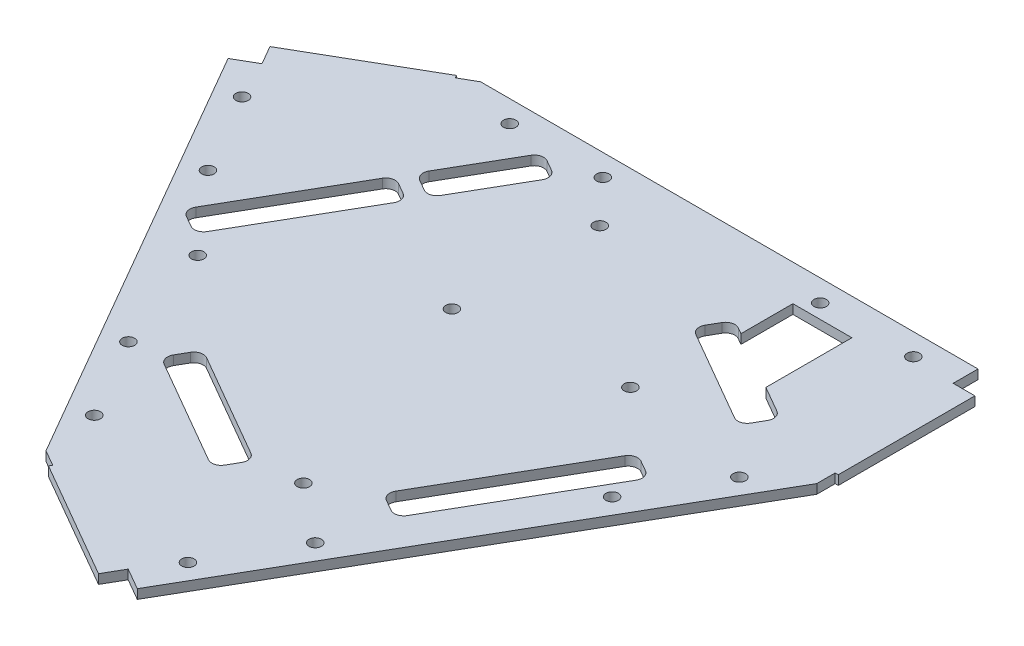
from build123d import *

# Parameters (mm, degrees)
EXTRUSION1_DEPTH         = 3
ENL_V_MAT_EXTRU_14_REACH = 176.1
ESQUISSE8_R              = 2
ESQUISSE10_R             = 2
ENL_V_MAT_EXTRU_16_DEPTH = 175.099861741
ENL_V_MAT_EXTRU_17_DEPTH = 175.099861741
ENL_V_MAT_EXTRU_18_DEPTH = 167.529952384
CONG_1_R                 = 3


with BuildPart() as part:
    # Esquisse1 → Extrusion1 (new body)
    with BuildSketch(Plane(origin=(0, 0, 0), x_dir=(1, 0, 0), z_dir=(0, 1, 0))):
        Polygon((-64.179491924, 79.940798285), (98.820508076, 79.940798285), (103.820508076, 74.940798285), (103.820508076, 24.940798285), (101.320508076, 15.610671266), (19.820508076, -125.551469551), (12.990381057, -127.38159657), (-30.310889132, -102.38159657), (-37.141016151, -95.551469551), (-118.641016151, 45.610671266), (-116.810889132, 52.440798285), (-73.509618943, 77.440798285), align=None)
    extrude(amount=EXTRUSION1_DEPTH)

    # Esquisse8 → Enlèv. mat.-Extru.14 (cut, up to next)
    with BuildSketch(Plane(origin=(0, 3, 0), x_dir=(1, 0, 0), z_dir=(0, 1, 0)), mode=Mode.PRIVATE) as enl_v_mat_extru_14_sk1:
        with Locations((-100.570508076, 34.31163316)):
            Circle(ESQUISSE8_R)
    enl_v_mat_extru_14_tool1 = extrude(enl_v_mat_extru_14_sk1.sketch, amount=-ENL_V_MAT_EXTRU_14_REACH, mode=Mode.PRIVATE) & part.part
    # Esquisse8 → Enlèv. mat.-Extru.14 (cut, up to next)
    with BuildSketch(Plane(origin=(0, 3, 0), x_dir=(1, 0, 0), z_dir=(0, 1, 0)), mode=Mode.PRIVATE) as enl_v_mat_extru_14_sk2:
        with Locations((80, 69.940798285)):
            Circle(ESQUISSE8_R)
    enl_v_mat_extru_14_tool2 = extrude(enl_v_mat_extru_14_sk2.sketch, amount=-ENL_V_MAT_EXTRU_14_REACH, mode=Mode.PRIVATE) & part.part
    # Esquisse8 → Enlèv. mat.-Extru.14 (cut, up to next)
    with BuildSketch(Plane(origin=(0, 3, 0), x_dir=(1, 0, 0), z_dir=(0, 1, 0)), mode=Mode.PRIVATE) as enl_v_mat_extru_14_sk3:
        with Locations((50, 69.940798285)):
            Circle(ESQUISSE8_R)
    enl_v_mat_extru_14_tool3 = extrude(enl_v_mat_extru_14_sk3.sketch, amount=-ENL_V_MAT_EXTRU_14_REACH, mode=Mode.PRIVATE) & part.part
    # Esquisse8 → Enlèv. mat.-Extru.14 (cut, up to next)
    with BuildSketch(Plane(origin=(0, 3, 0), x_dir=(1, 0, 0), z_dir=(0, 1, 0)), mode=Mode.PRIVATE) as enl_v_mat_extru_14_sk4:
        with Locations((-50.570508076, -52.290907218)):
            Circle(ESQUISSE8_R)
    enl_v_mat_extru_14_tool4 = extrude(enl_v_mat_extru_14_sk4.sketch, amount=-ENL_V_MAT_EXTRU_14_REACH, mode=Mode.PRIVATE) & part.part
    # Esquisse8 → Enlèv. mat.-Extru.14 (cut, up to next)
    with BuildSketch(Plane(origin=(0, 3, 0), x_dir=(1, 0, 0), z_dir=(0, 1, 0)), mode=Mode.PRIVATE) as enl_v_mat_extru_14_sk5:
        with Locations((-35.570508076, -78.271669332)):
            Circle(ESQUISSE8_R)
    enl_v_mat_extru_14_tool5 = extrude(enl_v_mat_extru_14_sk5.sketch, amount=-ENL_V_MAT_EXTRU_14_REACH, mode=Mode.PRIVATE) & part.part
    # Esquisse8 → Enlèv. mat.-Extru.14 (cut, up to next)
    with BuildSketch(Plane(origin=(0, 3, 0), x_dir=(1, 0, 0), z_dir=(0, 1, 0)), mode=Mode.PRIVATE) as enl_v_mat_extru_14_sk6:
        with Locations((-20, 69.940798285)):
            Circle(ESQUISSE8_R)
    enl_v_mat_extru_14_tool6 = extrude(enl_v_mat_extru_14_sk6.sketch, amount=-ENL_V_MAT_EXTRU_14_REACH, mode=Mode.PRIVATE) & part.part
    # Esquisse8 → Enlèv. mat.-Extru.14 (cut, up to next)
    with BuildSketch(Plane(origin=(0, 3, 0), x_dir=(1, 0, 0), z_dir=(0, 1, 0)), mode=Mode.PRIVATE) as enl_v_mat_extru_14_sk7:
        with Locations((-50, 69.940798285)):
            Circle(ESQUISSE8_R)
    enl_v_mat_extru_14_tool7 = extrude(enl_v_mat_extru_14_sk7.sketch, amount=-ENL_V_MAT_EXTRU_14_REACH, mode=Mode.PRIVATE) & part.part
    # Esquisse8 → Enlèv. mat.-Extru.14 (cut, up to next)
    with BuildSketch(Plane(origin=(0, 3, 0), x_dir=(1, 0, 0), z_dir=(0, 1, 0)), mode=Mode.PRIVATE) as enl_v_mat_extru_14_sk8:
        with Locations((20.570508076, -104.252431445)):
            Circle(ESQUISSE8_R)
    enl_v_mat_extru_14_tool8 = extrude(enl_v_mat_extru_14_sk8.sketch, amount=-ENL_V_MAT_EXTRU_14_REACH, mode=Mode.PRIVATE) & part.part
    # Esquisse8 → Enlèv. mat.-Extru.14 (cut, up to next)
    with BuildSketch(Plane(origin=(0, 3, 0), x_dir=(1, 0, 0), z_dir=(0, 1, 0)), mode=Mode.PRIVATE) as enl_v_mat_extru_14_sk9:
        with Locations((35.570508076, -78.271669332)):
            Circle(ESQUISSE8_R)
    enl_v_mat_extru_14_tool9 = extrude(enl_v_mat_extru_14_sk9.sketch, amount=-ENL_V_MAT_EXTRU_14_REACH, mode=Mode.PRIVATE) & part.part
    # Esquisse8 → Enlèv. mat.-Extru.14 (cut, up to next)
    with BuildSketch(Plane(origin=(0, 3, 0), x_dir=(1, 0, 0), z_dir=(0, 1, 0)), mode=Mode.PRIVATE) as enl_v_mat_extru_14_sk10:
        with Locations((-85.570508076, 8.330871047)):
            Circle(ESQUISSE8_R)
    enl_v_mat_extru_14_tool10 = extrude(enl_v_mat_extru_14_sk10.sketch, amount=-ENL_V_MAT_EXTRU_14_REACH, mode=Mode.PRIVATE) & part.part
    # Esquisse8 → Enlèv. mat.-Extru.14 (cut, up to next)
    with BuildSketch(Plane(origin=(0, 3, 0), x_dir=(1, 0, 0), z_dir=(0, 1, 0)), mode=Mode.PRIVATE) as enl_v_mat_extru_14_sk11:
        with Locations((70.570508076, -17.649891067)):
            Circle(ESQUISSE8_R)
    enl_v_mat_extru_14_tool11 = extrude(enl_v_mat_extru_14_sk11.sketch, amount=-ENL_V_MAT_EXTRU_14_REACH, mode=Mode.PRIVATE) & part.part
    # Esquisse8 → Enlèv. mat.-Extru.14 (cut, up to next)
    with BuildSketch(Plane(origin=(0, 3, 0), x_dir=(1, 0, 0), z_dir=(0, 1, 0)), mode=Mode.PRIVATE) as enl_v_mat_extru_14_sk12:
        with Locations((85.570508076, 8.330871047)):
            Circle(ESQUISSE8_R)
    enl_v_mat_extru_14_tool12 = extrude(enl_v_mat_extru_14_sk12.sketch, amount=-ENL_V_MAT_EXTRU_14_REACH, mode=Mode.PRIVATE) & part.part
    add(enl_v_mat_extru_14_tool1.solids().sort_by_distance((-100.570508, 3, -34.311633))[0], mode=Mode.SUBTRACT)
    add(enl_v_mat_extru_14_tool2.solids().sort_by_distance((80, 3, -69.940798))[0], mode=Mode.SUBTRACT)
    add(enl_v_mat_extru_14_tool3.solids().sort_by_distance((50, 3, -69.940798))[0], mode=Mode.SUBTRACT)
    add(enl_v_mat_extru_14_tool4.solids().sort_by_distance((-50.570508, 3, 52.290907))[0], mode=Mode.SUBTRACT)
    add(enl_v_mat_extru_14_tool5.solids().sort_by_distance((-35.570508, 3, 78.271669))[0], mode=Mode.SUBTRACT)
    add(enl_v_mat_extru_14_tool6.solids().sort_by_distance((-20, 3, -69.940798))[0], mode=Mode.SUBTRACT)
    add(enl_v_mat_extru_14_tool7.solids().sort_by_distance((-50, 3, -69.940798))[0], mode=Mode.SUBTRACT)
    add(enl_v_mat_extru_14_tool8.solids().sort_by_distance((20.570508, 3, 104.252431))[0], mode=Mode.SUBTRACT)
    add(enl_v_mat_extru_14_tool9.solids().sort_by_distance((35.570508, 3, 78.271669))[0], mode=Mode.SUBTRACT)
    add(enl_v_mat_extru_14_tool10.solids().sort_by_distance((-85.570508, 3, -8.330871))[0], mode=Mode.SUBTRACT)
    add(enl_v_mat_extru_14_tool11.solids().sort_by_distance((70.570508, 3, 17.649891))[0], mode=Mode.SUBTRACT)
    add(enl_v_mat_extru_14_tool12.solids().sort_by_distance((85.570508, 3, -8.330871))[0], mode=Mode.SUBTRACT)

    # Esquisse10 → Enlèv. mat.-Extru.16 (cut, through all)
    with BuildSketch(Plane(origin=(0, 3, 0), x_dir=(1, 0, 0), z_dir=(0, 1, 0))):
        with Locations((-63.520181276, -17.020181276)):
            Circle(ESQUISSE10_R)
        with Locations((17.020181276, -63.520181276)):
            Circle(ESQUISSE10_R)
        with Locations((42.965884077, 15.839094213)):
            Circle(ESQUISSE10_R)
        with Locations((-7.629221728, 8.965800345)):
            Circle(ESQUISSE10_R)
        with Locations((-7.029145761, 55.985162408)):
            Circle(ESQUISSE10_R)
    extrude(amount=-ENL_V_MAT_EXTRU_16_DEPTH, mode=Mode.SUBTRACT)

    # Esquisse12 → Enlèv. mat.-Extru.17 (cut, through all)
    with BuildSketch(Plane(origin=(0, 3, 0), x_dir=(1, 0, 0), z_dir=(0, 1, 0))):
        Polygon((98.820508076, 79.940798285), (93.820508076, 79.940798285), (-64.179491924, 79.940798285), (-73.509618943, 77.440798285), (-116.810889132, 52.440798285), (-117.908965344, 48.342722073), (-118.641016151, 45.610671266), (-116.141016151, 41.280544247), (-37.141016151, -95.551469551), (-30.310889132, -102.38159657), (12.990381057, -127.38159657), (17.088457269, -126.283520358), (19.820508076, -125.551469551), (22.320508076, -121.221342532), (101.320508076, 15.610671266), (103.820508076, 24.940798285), (103.820508076, 74.940798285), (100.820508076, 77.940798285), align=None)
        Polygon((-66.375644347, 76.940798285), (-65.977450895, 76.940798285), (93.820508076, 76.940798285), (93.820508076, 68.940798285), (100.820508076, 68.940798285), (100.820508076, 24.940798285), (99.820508076, 24.940798285), (99.820508076, 19.012595055), (99.62141135, 18.66774941), (19.722431865, -119.721342532), (12.794228634, -115.721342532), (9.294228634, -121.783520358), (-28.810889132, -99.783520358), (-28.310889132, -98.917494955), (-33.444863728, -95.953393339), (-33.643960454, -95.608547695), (-113.54293994, 42.780544247), (-106.61473671, 46.780544247), (-110.11473671, 52.842722074), (-72.009618943, 74.842722074), (-71.509618943, 73.97669667), align=None, mode=Mode.SUBTRACT)
    extrude(amount=-ENL_V_MAT_EXTRU_17_DEPTH, mode=Mode.SUBTRACT)

    # Esquisse13 → Enlèv. mat.-Extru.18 (cut, through all)
    with BuildSketch(Plane(origin=(0, 3, 0), x_dir=(1, 0, 0), z_dir=(0, 1, 0))):
        Polygon((-70.131397208, -11.47114317), (-45.131397208, 31.830127019), (-53.791651246, 36.830127019), (-78.791651246, -6.47114317), align=None)
        Polygon((-51.291651246, 41.160254038), (-36.291651246, 67.141016151), (-27.631397208, 62.141016151), (-42.631397208, 36.160254038), align=None)
        Polygon((32.631397208, -53.480762114), (62.631397208, -1.519237886), (71.291651246, -6.519237886), (41.291651246, -58.480762114), align=None)
        Polygon((70.801270189, 22.631397208), (36.160254038, 42.631397208), (41.160254038, 51.291651246), (45.803878216, 48.610653577), (45.803878216, 65.342402688), (64.803878216, 65.342402688), (64.803878216, 46.342402688), (64.803878216, 37.640998462), (75.801270189, 31.291651246), align=None)
        Polygon((2.810889132, -65.131397208), (-36.160254038, -42.631397208), (-41.160254038, -51.291651246), (-2.189110868, -73.791651246), align=None)
    extrude(amount=-ENL_V_MAT_EXTRU_18_DEPTH, mode=Mode.SUBTRACT)

    # Congé1
    cong_1_edges = [part.edges().sort_by_distance(p)[0] for p in [
        (-41.160254038, 1.5, 51.291651246),
        (-36.160254038, 1.5, 42.631397208),
        (2.810889132, 1.5, 65.131397208),
        (-2.189110868, 1.5, 73.791651246),
        (32.631397208, 1.5, 53.480762114),
        (41.291651246, 1.5, 58.480762114),
        (62.631397208, 1.5, 1.519237886),
        (71.291651246, 1.5, 6.519237886),
        (36.160254038, 1.5, -42.631397208),
        (70.801270189, 1.5, -22.631397208),
        (41.160254038, 1.5, -51.291651246),
        (-36.291651246, 1.5, -67.141016151),
        (-27.631397208, 1.5, -62.141016151),
        (-51.291651246, 1.5, -41.160254038),
        (-42.631397208, 1.5, -36.160254038),
        (-70.131397208, 1.5, 11.47114317),
        (-45.131397208, 1.5, -31.830127019),
        (-78.791651246, 1.5, 6.47114317),
        (-53.791651246, 1.5, -36.830127019),
        (75.801270189, 1.5, -31.291651246),
    ]]
    fillet(cong_1_edges, radius=CONG_1_R)


solid = part.part
